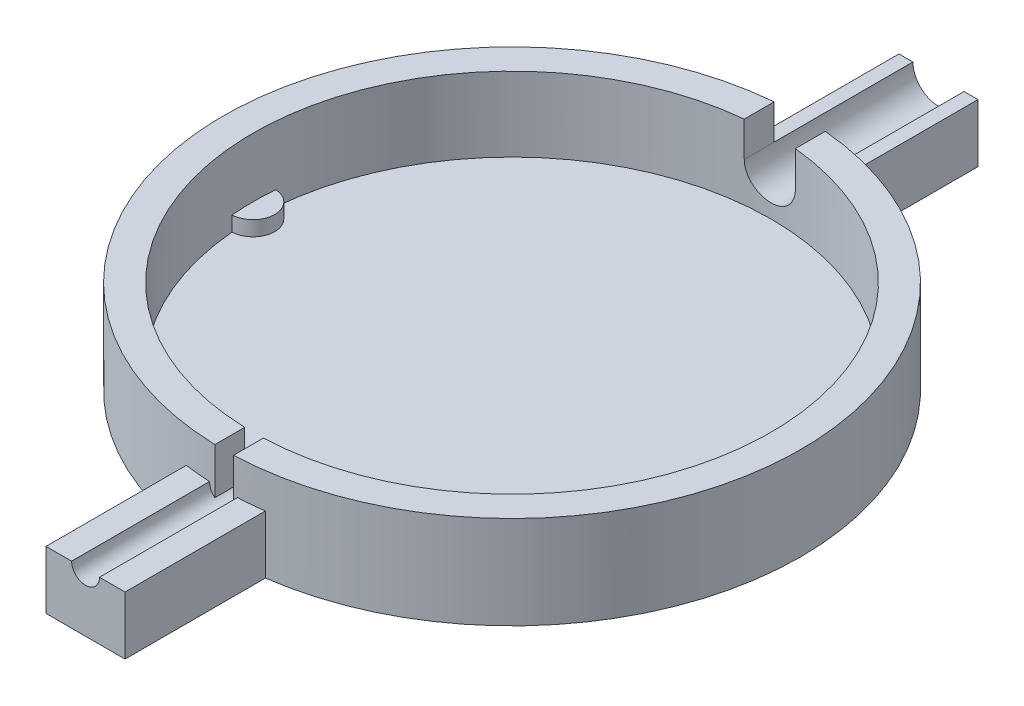
from build123d import *

# Parameters (mm, degrees)
SKETCH1_R           = 31.06
BOSS_EXTRUDE1_DEPTH = 10
SKETCH2_R           = 27.86
CUT_EXTRUDE1_DEPTH  = 8
BOSS_EXTRUDE2_START = 1.6
BOSS_EXTRUDE2_DEPTH = 1.6
CUT_EXTRUDE2_DEPTH  = 46.049386233
SKETCH5_W           = 2
SKETCH5_H           = 6.000963959
CUT_EXTRUDE3_DEPTH  = 46.049386417
BOSS_EXTRUDE3_DEPTH = 18
BOSS_EXTRUDE4_DEPTH = 18


with BuildPart() as part:
    # Sketch1 → Boss-Extrude1 (new body)
    with BuildSketch(Plane(origin=(0, 0, 0), x_dir=(1, 0, 0), z_dir=(0, 1, 0))):
        Circle(SKETCH1_R)
    extrude(amount=BOSS_EXTRUDE1_DEPTH)

    # Sketch2 → Cut-Extrude1 (cut)
    with BuildSketch(Plane(origin=(0, 10, 0), x_dir=(1, 0, 0), z_dir=(0, 1, 0))):
        Circle(SKETCH2_R)
    extrude(amount=-CUT_EXTRUDE1_DEPTH, mode=Mode.SUBTRACT)

    # Sketch3 → Boss-Extrude2 (add)
    with BuildSketch(Plane(origin=(0, 2, 0), x_dir=(1, 0, 0), z_dir=(0, 1, 0)).offset(BOSS_EXTRUDE2_START)):
        with BuildLine():
            ThreePointArc((-27.76088837, -2.347909045), (-25.51, 0), (-27.76088837, 2.347909045))
            ThreePointArc((-27.76088837, 2.347909045), (-27.86, 0), (-27.76088837, -2.347909045))
        make_face()
        with BuildLine():
            ThreePointArc((27.76088837, 2.347909045), (25.51, 0), (27.76088837, -2.347909045))
            ThreePointArc((27.76088837, -2.347909045), (27.86, 0), (27.76088837, 2.347909045))
        make_face()
    extrude(amount=-BOSS_EXTRUDE2_DEPTH)

    # Sketch4 → Cut-Extrude2 (cut, through all)
    with BuildSketch(Plane.XY):
        with BuildLine():
            Line((2.75, 6.25), (2.75, 10))
            Line((2.75, 10), (-2.75, 10))
            Line((-2.75, 10), (-2.75, 6.25))
            ThreePointArc((-2.75, 6.25), (-1.944543648, 4.305456352), (0, 3.5))
            ThreePointArc((0, 3.5), (1.944543648, 4.305456352), (2.75, 6.25))
        make_face()
    extrude(amount=-CUT_EXTRUDE2_DEPTH, mode=Mode.SUBTRACT)

    # Sketch5 → Cut-Extrude3 (cut, through all)
    with BuildSketch(Plane.XY):
        with Locations((0.098176677, 6.999518021)):
            Rectangle(SKETCH5_W, SKETCH5_H)
    extrude(amount=CUT_EXTRUDE3_DEPTH, mode=Mode.SUBTRACT)

    # Sketch6 → Boss-Extrude3 (add)
    with BuildSketch(Plane.XY.offset(-27.86)):
        with BuildLine():
            Line((-4.25, 0), (4.25, 0))
            Line((4.25, 0), (4.25, 6.25))
            Line((4.25, 6.25), (2.75, 6.25))
            ThreePointArc((2.75, 6.25), (0, 3.5), (-2.75, 6.25))
            Line((-2.75, 6.25), (-4.25, 6.25))
            Line((-4.25, 6.25), (-4.25, 0))
        make_face()
    extrude(amount=-BOSS_EXTRUDE3_DEPTH)

    # Sketch7 → Boss-Extrude4 (add)
    with BuildSketch(Plane(origin=(0, 0, 27.86), x_dir=(-1, 0, 0), z_dir=(0, 0, -1))):
        with BuildLine():
            Line((4.25, 6.25), (1.5, 6.25))
            ThreePointArc((1.5, 6.25), (0, 4.75), (-1.5, 6.25))
            Line((-1.5, 6.25), (-4.25, 6.25))
            Line((-4.25, 6.25), (-4.25, 0))
            Line((-4.25, 0), (4.25, 0))
            Line((4.25, 0), (4.25, 6.25))
        make_face()
    extrude(amount=-BOSS_EXTRUDE4_DEPTH)


solid = part.part
